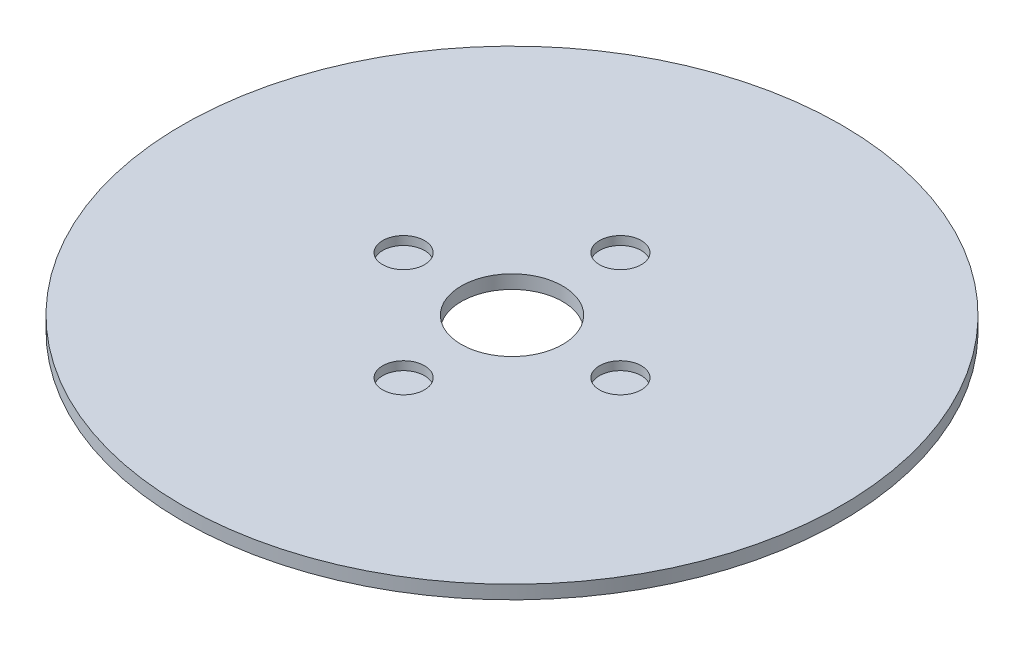
from build123d import *

# Parameters (mm, degrees)
SKETCH1_R           = 97.5
BOSS_EXTRUDE1_DEPTH = 4
SKETCH2_R           = 15
CUT_EXTRUDE1_DEPTH  = 138.943829148
SKETCH3_R           = 6.190484791
CUT_EXTRUDE2_DEPTH  = 2.553092026
CIRPATTERN1_COUNT   = 4


with BuildPart() as part:
    # Sketch1 → Boss-Extrude1 (new body)
    with BuildSketch(Plane(origin=(0, 0, 0), x_dir=(1, 0, 0), z_dir=(0, 1, 0))):
        Circle(SKETCH1_R)
    extrude(amount=BOSS_EXTRUDE1_DEPTH)

    # Sketch2 → Cut-Extrude1 (cut, through all)
    with BuildSketch(Plane(origin=(0, 0, 0), x_dir=(1, 0, 0), z_dir=(0, 1, 0))):
        Circle(SKETCH2_R)
    extrude(amount=CUT_EXTRUDE1_DEPTH, mode=Mode.SUBTRACT)

    # Sketch3 → Cut-Extrude2 (cut)
    with BuildSketch(Plane(origin=(0, 4, 0), x_dir=(1, 0, 0), z_dir=(0, 1, 0))):
        with Locations((-32.071903969, 0)):
            Circle(SKETCH3_R)
    cut_extrude2 = extrude(amount=-CUT_EXTRUDE2_DEPTH, mode=Mode.SUBTRACT)

    # CirPattern1: Cut-Extrude2 ×4 about axis
    cirpattern1_axis = Axis((0, 0, 0), (0, 1, 0))
    for i in range(1, CIRPATTERN1_COUNT):
        add(cut_extrude2.rotate(cirpattern1_axis, i * 360 / CIRPATTERN1_COUNT), mode=Mode.SUBTRACT)


solid = part.part
